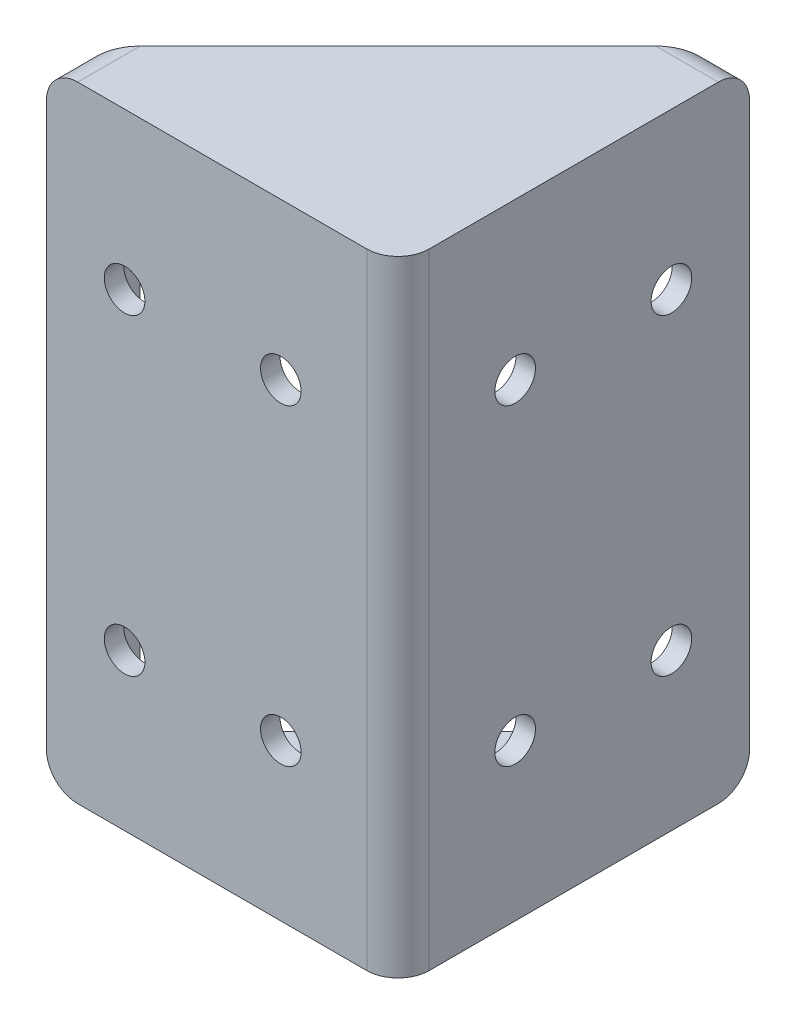
from build123d import *

# Parameters (mm, degrees)
SKETCH1_W           = 45
SKETCH1_H           = 80
BOSS_EXTRUDE1_DEPTH = 45
SKETCH3_R           = 2.6
CUT_EXTRUDE1_DEPTH  = 40
SHELL1_OUTLINE_R    = 6.6
SHELL1_DEPTH        = 41
SHELL1_2_OUTLINE_R  = 6.6
SHELL1_2_DEPTH      = 1
CUT_EXTRUDE2_DEPTH  = 96.338073399
SKETCH5_W           = 37
SKETCH5_H           = 72
CUT_EXTRUDE3_DEPTH  = 40
SKETCH6_R           = 2.6
CUT_EXTRUDE4_DEPTH  = 40
FILLET1_R           = 4
FILLET2_R           = 4
FILLET3_R           = 4
SKETCH8_R           = 6.25
CUT_EXTRUDE5_DEPTH  = 1.5
SKETCH7_R           = 6.25
CUT_EXTRUDE6_DEPTH  = 1.5


# Read off the part's stored shape, not the designer's step: Shell1
with BuildPart() as part:
    # Sketch1 → Boss-Extrude1 (new body)
    with BuildSketch(Plane.XY):
        with Locations((3.274953722, 5.904112676)):
            Rectangle(SKETCH1_W, SKETCH1_H)
    extrude(amount=BOSS_EXTRUDE1_DEPTH)

    # Sketch3 → Cut-Extrude1 (cut)
    with BuildSketch(Plane(origin=(0, 0, 45), x_dir=(-1, 0, 0), z_dir=(0, 0, 1))):
        with Locations(Location((-10.774953722, -25.904112676, 0), (0, 0, 180))):
            Circle(SKETCH3_R)
        with Locations(Location((-10.774953722, 14.095887324, 0), (0, 0, 180))):
            Circle(SKETCH3_R)
        with Locations(Location((9.225046278, 14.095887324, 0), (0, 0, 180))):
            Circle(SKETCH3_R)
        with Locations(Location((9.225046278, -25.904112676, 0), (0, 0, 180))):
            Circle(SKETCH3_R)
    extrude(amount=-CUT_EXTRUDE1_DEPTH, mode=Mode.SUBTRACT)

    # Shell1 outline → Shell1 (cut)
    with BuildSketch(Plane.XY):
        with BuildLine():
            Line((-15.225046278, -16.845432741), (-15.225046278, -30.095887324))
            Line((-15.225046278, -30.095887324), (21.774953722, -30.095887324))
            Line((21.774953722, -30.095887324), (21.774953722, 41.904112676))
            Line((21.774953722, 41.904112676), (-15.225046278, 41.904112676))
            Line((-15.225046278, 41.904112676), (-15.225046278, 28.653658093))
            ThreePointArc((-15.225046278, 28.653658093), (-2.625046278, 25.904112676), (-15.225046278, 23.154567259))
            Line((-15.225046278, 23.154567259), (-15.225046278, -11.346341907))
            ThreePointArc((-15.225046278, -11.346341907), (-2.625046278, -14.095887324), (-15.225046278, -16.845432741))
        make_face()
        with Locations((10.774953722, -14.095887324)):
            Circle(SHELL1_OUTLINE_R, mode=Mode.SUBTRACT)
        with Locations((10.774953722, 25.904112676)):
            Circle(SHELL1_OUTLINE_R, mode=Mode.SUBTRACT)
    extrude(amount=SHELL1_DEPTH, mode=Mode.SUBTRACT)

    # Shell1 2 outline → Shell1 2 (cut)
    with BuildSketch(Plane.XY):
        with BuildLine():
            Line((-15.225046278, -11.346341907), (-15.225046278, -16.845432741))
            ThreePointArc((-15.225046278, -16.845432741), (-2.625046278, -14.095887324), (-15.225046278, -11.346341907))
        make_face()
        with BuildLine():
            Line((-15.225046278, 28.653658093), (-15.225046278, 23.154567259))
            ThreePointArc((-15.225046278, 23.154567259), (-2.625046278, 25.904112676), (-15.225046278, 28.653658093))
        make_face()
        with Locations((10.774953722, -14.095887324)):
            Circle(SHELL1_2_OUTLINE_R)
        with Locations((10.774953722, 25.904112676)):
            Circle(SHELL1_2_OUTLINE_R)
    extrude(amount=SHELL1_2_DEPTH, mode=Mode.SUBTRACT)

    # Sketch4 → Cut-Extrude2 (cut, through all)
    with BuildSketch(Plane(origin=(0, 45.904112676, 0), x_dir=(1, 0, 0), z_dir=(0, 1, 0))):
        Polygon((-19.225046278, 0), (-19.225046278, -41), (21.774953722, 0), align=None)
    extrude(amount=-CUT_EXTRUDE2_DEPTH, mode=Mode.SUBTRACT)

    # Sketch5 → Cut-Extrude3 (cut)
    with BuildSketch(Plane(origin=(0, 0, 41), x_dir=(-1, 0, 0), z_dir=(0, 0, -1))):
        with Locations((-3.274953722, 5.904112676)):
            Rectangle(SKETCH5_W, SKETCH5_H)
    extrude(amount=CUT_EXTRUDE3_DEPTH, mode=Mode.SUBTRACT)

    # Sketch6 → Cut-Extrude4 (cut)
    with BuildSketch(Plane(origin=(25.774953722, 0, 0), x_dir=(0, 0, 1), z_dir=(1, 0, 0))):
        with Locations(Location((10, -25.904112676, 0), (0, 0, 180))):
            Circle(SKETCH6_R)
        with Locations(Location((10, 14.095887324, 0), (0, 0, 180))):
            Circle(SKETCH6_R)
        with Locations(Location((30, 14.095887324, 0), (0, 0, 180))):
            Circle(SKETCH6_R)
        with Locations(Location((30, -25.904112676, 0), (0, 0, 180))):
            Circle(SKETCH6_R)
    extrude(amount=-CUT_EXTRUDE4_DEPTH, mode=Mode.SUBTRACT)

    # Fillet1
    fillet1_edges = [part.edges().sort_by_distance(p)[0] for p in [
        (3.274953722, -30.095887324, 41),
        (21.774953722, -30.095887324, 20.5),
        (21.774953722, 41.904112676, 20.5),
        (21.774953722, 5.904112676, 41),
        (3.274953722, 41.904112676, 41),
    ]]
    fillet(fillet1_edges, radius=FILLET1_R)

    # Fillet2
    fillet2_edges = [part.edges().sort_by_distance(p)[0] for p in [
        (23.774953722, -34.095887324, 0),
        (23.774953722, 45.904112676, 0),
        (-19.225046278, -34.095887324, 43),
        (-19.225046278, 45.904112676, 43),
    ]]
    fillet(fillet2_edges, radius=FILLET2_R)

    # Fillet3
    fillet3_edges = [part.edges().sort_by_distance(p)[0] for p in [
        (25.774953722, 5.904112676, 45),
    ]]
    fillet(fillet3_edges, radius=FILLET3_R)

    # Sketch8 → Cut-Extrude5 (cut)
    with BuildSketch(Plane(origin=(0, 0, 41), x_dir=(-1, 0, 0), z_dir=(0, 0, -1))):
        with Locations((-10.774953722, -14.095887324)):
            Circle(SKETCH8_R)
        with Locations((-10.774953722, 25.904112676)):
            Circle(SKETCH8_R)
        with Locations((9.225046278, 25.904112676)):
            Circle(SKETCH8_R)
        with Locations((9.225046278, -14.095887324)):
            Circle(SKETCH8_R)
    extrude(amount=-CUT_EXTRUDE5_DEPTH, mode=Mode.SUBTRACT)

    # Sketch7 → Cut-Extrude6 (cut)
    with BuildSketch(Plane.ZY.offset(-21.774953722)):
        with Locations((10, 25.904112676)):
            Circle(SKETCH7_R)
        with Locations((30, 25.904112676)):
            Circle(SKETCH7_R)
        with Locations((30, -14.095887324)):
            Circle(SKETCH7_R)
        with Locations((10, -14.095887324)):
            Circle(SKETCH7_R)
    extrude(amount=-CUT_EXTRUDE6_DEPTH, mode=Mode.SUBTRACT)


solid = part.part
